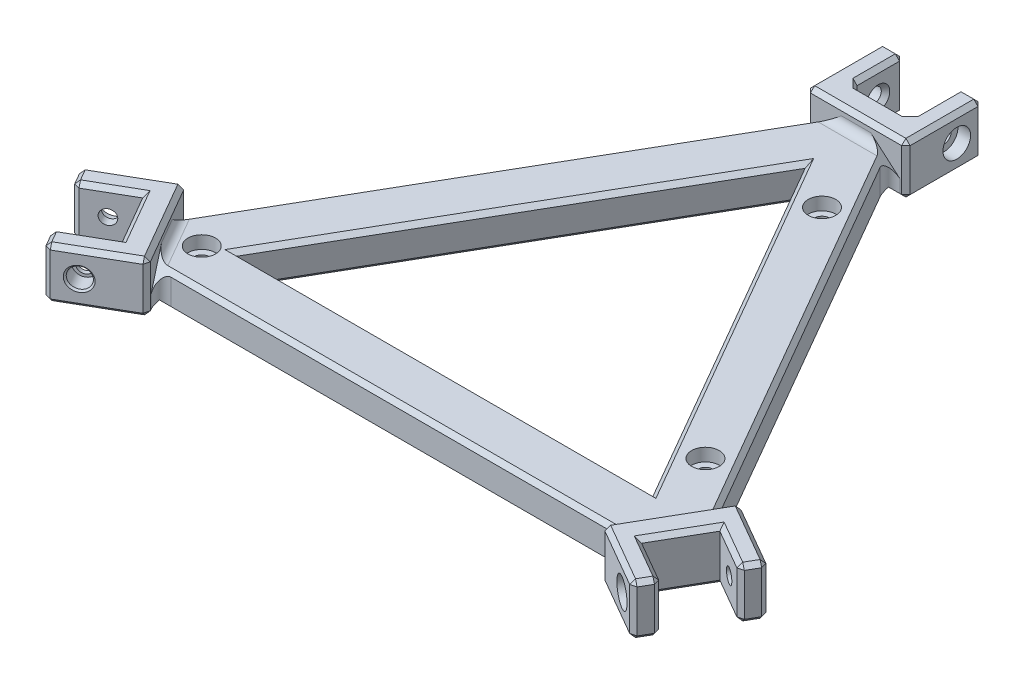
from build123d import *

# Parameters (mm, degrees)
BOSS_EXTRUDE1_DEPTH            = 8
BOSS_EXTRUDE2_DEPTH            = 12
CBORE_FOR_M3_SHCS1_D           = 3.4
CBORE_FOR_M3_SHCS1_DEPTH       = 5
CBORE_FOR_M3_SHCS1_CBORE_D     = 6.5
CBORE_FOR_M3_SHCS1_CBORE_DEPTH = 3
CBORE_FOR_M3_SHCS2_D           = 3.4
CBORE_FOR_M3_SHCS2_DEPTH       = 5
CBORE_FOR_M3_SHCS2_CBORE_D     = 6.5
CBORE_FOR_M3_SHCS2_CBORE_DEPTH = 3
CBORE_FOR_M3_SHCS3_D           = 3.4
CBORE_FOR_M3_SHCS3_DEPTH       = 5
CBORE_FOR_M3_SHCS3_CBORE_D     = 6.5
CBORE_FOR_M3_SHCS3_CBORE_DEPTH = 3
SKETCH10_R                     = 2.3499999999999965
CUT_EXTRUDE1_DEPTH             = 4
SKETCH10_4_R                   = 1.7000000000000066
CUT_EXTRUDE6_DEPTH             = 5
SKETCH11_R                     = 2.350000000000004
CUT_EXTRUDE7_DEPTH             = 4
CUT_EXTRUDE8_REACH             = 159.66
SKETCH11_3_R                   = 1.6999999999999988
SKETCH12_R                     = 2.3499999999999965
CUT_EXTRUDE9_DEPTH             = 4
CUT_EXTRUDE10_REACH            = 143.889
SKETCH12_3_R                   = 1.6999999999999924
CBORE_FOR_M3_SHCS4_D           = 3.4
CBORE_FOR_M3_SHCS4_CBORE_D     = 6.5
CBORE_FOR_M3_SHCS4_CBORE_DEPTH = 3
CHAMFER1_SIZE                  = 0.4
CHAMFER2_SIZE                  = 1
FILLET1_R                      = 2


with BuildPart() as part:
    # Sketch1 → Boss-Extrude1 (new body)
    with BuildSketch(Plane(origin=(0, 0, 0), x_dir=(1, 0, 0), z_dir=(0, 1, 0))):
        Polygon((6.928203230275441, 108.98374890868618), (-6.928203230275446, 108.98374890868618), (-62.921796769724494, 12.000000000000014), (-55.99359353944898, 4.086e-14), (55.99359353944894, 9.495e-14), (62.92179676972445, 12.000000000000089), align=None)
        Polygon((-49.06539030917352, 12), (-3.296e-14, 96.98374890868608), (49.065390309173445, 12), align=None, mode=Mode.SUBTRACT)
    extrude(amount=BOSS_EXTRUDE1_DEPTH)

    # Sketch1<3> → Boss-Extrude2 (add)
    with BuildSketch(Plane(origin=(0, 0, 0), x_dir=(1, 0, 0), z_dir=(0, 1, 0))):
        Polygon((-66.38589838486224, 6.000000000000014), (-62.921796769724494, 12.000000000000014), (-65.33269515458673, 16.17579849446717), (-80.92115242270663, 7.175798494467191), (-78.42115242270663, 2.8456714755449983), (-68.02884757729336, 8.845671475544995), align=None)
        Polygon((-55.99359353944898, 4.086e-14), (-62.921796769724494, 12.000000000000028), (-66.38589838486224, 6.000000000000014), (-62.921796769724494, 3.73e-14), align=None)
        Polygon((-53.58269515458674, -4.1757984944671085), (-55.99359353944898, 4.086e-14), (-62.921796769724494, 3.589e-14), (-61.27884757729337, -2.8456714755449273), (-71.67115242270664, -8.84567147554493), (-69.17115242270663, -13.175798494467118), align=None)
        Polygon((62.92179676972444, 9.839e-14), (55.99359353944894, 9.495e-14), (53.58269515458671, -4.175798494467038), (69.1711524227066, -13.175798494467061), (71.67115242270658, -8.845671475544862), (61.27884757729331, -2.845671475544865), align=None)
        Polygon((66.3858983848622, 6.000000000000099), (62.92179676972445, 12.000000000000087), (55.99359353944894, 8.882e-14), (62.92179676972444, 9.839e-14), align=None)
        Polygon((65.33269515458662, 16.175798494467106), (62.92179676972445, 12.000000000000089), (66.3858983848622, 6.000000000000099), (68.02884757729332, 8.845671475545066), (78.4211524227065, 2.845671475544936), (80.92115242270651, 7.175798494467119), align=None)
        Polygon((-11.750000000000014, 126.9837489086862), (-11.750000000000012, 108.98374890868618), (11.750000000000016, 108.98374890868618), (11.750000000000014, 126.9837489086862), (6.749999999999987, 126.9837489086862), (6.749999999999987, 114.98374890868594), (-6.750000000000013, 114.98374890868594), (-6.750000000000013, 126.9837489086862), align=None)
    extrude(amount=BOSS_EXTRUDE2_DEPTH)

    # CBORE for M3 SHCS1
    with Locations(Plane(origin=(11.750000000000027, 0, -1.13e-15), x_dir=(-1.4e-16, 0, -1), z_dir=(1, 0, -1.4e-16))):
        with Locations((120.983748909, 6)):
            CounterBoreHole(CBORE_FOR_M3_SHCS1_D / 2, CBORE_FOR_M3_SHCS1_CBORE_D / 2, CBORE_FOR_M3_SHCS1_CBORE_DEPTH, depth=CBORE_FOR_M3_SHCS1_DEPTH)

    # CBORE for M3 SHCS2
    with Locations(Plane(origin=(11.587500000000121, 0, -20.070138732704503), x_dir=(0.8660254037844379, 0, 0.5000000000000014), z_dir=(-0.5000000000000014, 0, 0.8660254037844379))):
        with Locations((60.491874454, 6)):
            CounterBoreHole(CBORE_FOR_M3_SHCS2_D / 2, CBORE_FOR_M3_SHCS2_CBORE_D / 2, CBORE_FOR_M3_SHCS2_CBORE_DEPTH, depth=CBORE_FOR_M3_SHCS2_DEPTH)

    # CBORE for M3 SHCS3
    with Locations(Plane(origin=(-23.337499999999945, 0, -40.421735721638676), x_dir=(-0.8660254037844393, 0, 0.499999999999999), z_dir=(-0.499999999999999, 0, -0.8660254037844393))):
        with Locations((60.491874454, 6)):
            CounterBoreHole(CBORE_FOR_M3_SHCS3_D / 2, CBORE_FOR_M3_SHCS3_CBORE_D / 2, CBORE_FOR_M3_SHCS3_CBORE_DEPTH, depth=CBORE_FOR_M3_SHCS3_DEPTH)

    # Sketch10 → Cut-Extrude1 (cut)
    with BuildSketch(Plane(origin=(23.33749999999991, 0, -40.42173572163859), x_dir=(-0.8660254037844389, 0, -0.4999999999999996), z_dir=(0.4999999999999996, 0, -0.8660254037844389))):
        with Locations((-60.491874454342984, 6)):
            Circle(SKETCH10_R)
    extrude(amount=-CUT_EXTRUDE1_DEPTH, mode=Mode.SUBTRACT)

    # Sketch10<4> → Cut-Extrude6 (cut)
    with BuildSketch(Plane(origin=(23.33749999999991, 0, -40.42173572163859), x_dir=(-0.8660254037844389, 0, -0.4999999999999996), z_dir=(0.4999999999999996, 0, -0.8660254037844389))):
        with Locations(Location((-60.491874454342984, 6, 0), (0, 0, 180))):
            Circle(SKETCH10_4_R)
    extrude(amount=-CUT_EXTRUDE6_DEPTH, mode=Mode.SUBTRACT)

    # Sketch11 → Cut-Extrude7 (cut)
    with BuildSketch(Plane.ZY.offset(11.750000000000002)):
        with Locations((-120.98374890868607, 6)):
            Circle(SKETCH11_R)
    extrude(amount=-CUT_EXTRUDE7_DEPTH, mode=Mode.SUBTRACT)

    # Sketch11<3> → Cut-Extrude8 (cut, up to next)
    with BuildSketch(Plane.ZY.offset(11.750000000000002), mode=Mode.PRIVATE) as cut_extrude8_sk1:
        with Locations(Location((-120.98374890868607, 6, 0), (0, 0, 180))):
            Circle(SKETCH11_3_R)
    cut_extrude8_tool1 = extrude(cut_extrude8_sk1.sketch, amount=-CUT_EXTRUDE8_REACH, mode=Mode.PRIVATE) & part.part
    add(cut_extrude8_tool1.solids().sort_by_distance((-11.75, 6, -120.983749))[0], mode=Mode.SUBTRACT)

    # Sketch12 → Cut-Extrude9 (cut)
    with BuildSketch(Plane(origin=(-11.587500000000047, 0, -20.07013873270442), x_dir=(0.8660254037844384, 0, -0.5000000000000006), z_dir=(0.5000000000000006, 0, 0.8660254037844385))):
        with Locations((-60.491874454343005, 6)):
            Circle(SKETCH12_R)
    extrude(amount=-CUT_EXTRUDE9_DEPTH, mode=Mode.SUBTRACT)

    # Sketch12<3> → Cut-Extrude10 (cut, up to next)
    with BuildSketch(Plane(origin=(-11.587500000000047, 0, -20.07013873270442), x_dir=(0.8660254037844384, 0, -0.5000000000000006), z_dir=(0.5000000000000006, 0, 0.8660254037844385)), mode=Mode.PRIVATE) as cut_extrude10_sk1:
        with Locations(Location((-60.491874454343005, 6, 0), (0, 0, 180))):
            Circle(SKETCH12_3_R)
    cut_extrude10_tool1 = extrude(cut_extrude10_sk1.sketch, amount=-CUT_EXTRUDE10_REACH, mode=Mode.PRIVATE) & part.part
    add(cut_extrude10_tool1.solids().sort_by_distance((-63.975, 6, 10.175798))[0], mode=Mode.SUBTRACT)

    # CBORE for M3 SHCS4 (through all)
    with Locations(Plane(origin=(0, 8, 0), x_dir=(1, 0, 0), z_dir=(0, 1, 0))):
        with Locations((10.965136199, 89.9915759), (-54.261542732, 9), (48.492558956, 24.992173009)):
            CounterBoreHole(CBORE_FOR_M3_SHCS4_D / 2, CBORE_FOR_M3_SHCS4_CBORE_D / 2, CBORE_FOR_M3_SHCS4_CBORE_DEPTH)

    # Chamfer1
    chamfer1_edges = [part.edges().sort_by_distance(p)[0] for p in [
        (77.7601596988933, 6, -9.000798494467126),
        (-11.74999999999999, 6, -123.33374890868608),
        (-66.01015969889342, 6, 11.350798494467107),
    ]]
    chamfer(chamfer1_edges, length=CHAMFER1_SIZE)

    # Chamfer2
    chamfer2_edges = [part.edges().sort_by_distance(p)[0] for p in [
        (6.750000000000009, 6, -122.683748909),
        (-34.92499999999997, 0, -60.4918744543431),
        (-3.553e-14, 8, -12),
        (34.92499999999995, 0, -60.49187445434313),
        (-2.132e-14, 0, -6.714e-14),
        (-6.750000000000013, 6, -119.28374890868606),
        (-24.532695154586776, 0, -54.49187445434304),
        (-3.553e-14, 0, -12),
        (24.532695154586705, 0, -54.49187445434304),
        (-24.532695154586776, 8, -54.49187445434304),
        (-2.132e-14, 8, -6.714e-14),
        (-73.225, 0, -5.8456714755449966),
        (-78.42115242270663, 6, -2.8456714755449983),
        (-64.65384757729336, 0, -3.0000000000000333),
        (-66.47500000000001, 0, 5.845671475544929),
        (-70.42115242270663, 0, 11.010734985006025),
        (-71.67115242270664, 6, 8.84567147554493),
        (-61.37692378864668, 0, 8.675798494467113),
        (-69.17115242270663, 6, 13.175798494467118),
        (-64.12724596215561, 0, -14.087899247233599),
        (-53.58269515458674, 6, 4.175798494467108),
        (-54.78814434701786, 0, 2.087899247233534),
        (-73.12692378864668, 0, -11.67579849446718),
        (-65.33269515458673, 6, -16.17579849446717),
        (-79.67115242270663, 0, -5.010734985006095),
        (-80.92115242270663, 6, -7.175798494467191),
        (-73.225, 12, -5.8456714755449966),
        (-64.65384757729336, 12, -3.0000000000000338),
        (-66.47500000000001, 12, 5.845671475544929),
        (-70.42115242270663, 12, 11.010734985006025),
        (-61.37692378864668, 12, 8.675798494467113),
        (-59.45769515458674, 12, -6.000000000000032),
        (-73.12692378864668, 12, -11.67579849446718),
        (-79.67115242270663, 12, -5.010734985006095),
        (34.92499999999995, 8, -60.49187445434313),
        (-34.92499999999997, 8, -60.4918744543431),
        (66.47499999999995, 0, 5.845671475544863),
        (71.67115242270658, 6, 8.845671475544862),
        (64.65384757729332, 0, -3.0000000000001004),
        (73.22499999999991, 0, -5.845671475545001),
        (79.67115242270651, 0, -5.010734985006028),
        (78.4211524227065, 6, -2.845671475544936),
        (73.12692378864656, 0, -11.675798494467113),
        (80.92115242270651, 6, -7.175798494467119),
        (54.78814434701783, 0, 2.087899247233473),
        (65.33269515458662, 6, -16.175798494467106),
        (64.12724596215553, 0, -14.087899247233597),
        (61.37692378864665, 0, 8.675798494467049),
        (53.58269515458671, 6, 4.175798494467038),
        (70.4211524227066, 0, 11.01073498500596),
        (69.1711524227066, 6, 13.175798494467061),
        (66.47499999999995, 12, 5.845671475544863),
        (64.65384757729332, 12, -3.0000000000001004),
        (73.22499999999991, 12, -5.845671475545001),
        (79.67115242270651, 12, -5.010734985006028),
        (73.12692378864656, 12, -11.675798494467113),
        (59.45769515458666, 12, -6.000000000000034),
        (61.37692378864665, 12, 8.675798494467049),
        (70.4211524227066, 12, 11.01073498500596),
        (-9.250000000000014, 0, -126.9837489086862),
        (24.532695154586705, 8, -54.49187445434304),
        (-6.750000000000013, 6, -126.9837489086862),
        (-11.750000000000014, 0, -117.98374890868618),
        (9.33910161513773, 0, -108.98374890868618),
        (-11.750000000000012, 6, -108.98374890868618),
        (-9.339101615137729, 0, -108.98374890868618),
        (11.750000000000014, 0, -117.98374890868618),
        (11.750000000000016, 6, -108.98374890868618),
        (9.25, 0, -126.9837489086862),
        (11.750000000000014, 6, -126.9837489086862),
        (6.749999999999987, 0, -120.98374890868607),
        (6.749999999999987, 6, -126.9837489086862),
        (-1.332e-14, 0, -114.98374890868594),
        (6.749999999999987, 6, -114.98374890868594),
        (-6.750000000000013, 0, -120.98374890868607),
        (-6.750000000000013, 6, -114.98374890868594),
        (-9.250000000000014, 12, -126.9837489086862),
        (-11.750000000000014, 12, -117.98374890868618),
        (1.78e-15, 12, -108.98374890868618),
        (11.750000000000014, 12, -117.98374890868618),
        (9.25, 12, -126.9837489086862),
        (6.749999999999987, 12, -120.98374890868607),
        (-1.332e-14, 12, -114.98374890868594),
        (-6.750000000000013, 12, -120.98374890868607),
    ]]
    chamfer(chamfer2_edges, length=CHAMFER2_SIZE - 0.0001)  # a hair under: the kernel refuses the full size

    # Fillet1
    fillet1_edges = [part.edges().sort_by_distance(p)[0] for p in [
        (62.92179676972445, 4, -12.000000000000089),
        (59.457695154586695, 8, -6.000000000000094),
        (55.99359353944894, 4, -9.188e-14),
        (6.928203230275442, 4.000000000000004, -108.98374890868618),
        (-6.928203230275446, 3.999999999999999, -108.98374890868618),
        (8.88e-15, 8, -108.98374890868618),
        (-55.99359353944898, 4, -4.009e-14),
        (-59.457695154586744, 8, -6.000000000000043),
        (-62.921796769724494, 4.00000000000001, -12.000000000000021),
    ]]
    fillet(fillet1_edges, radius=FILLET1_R)


solid = part.part
